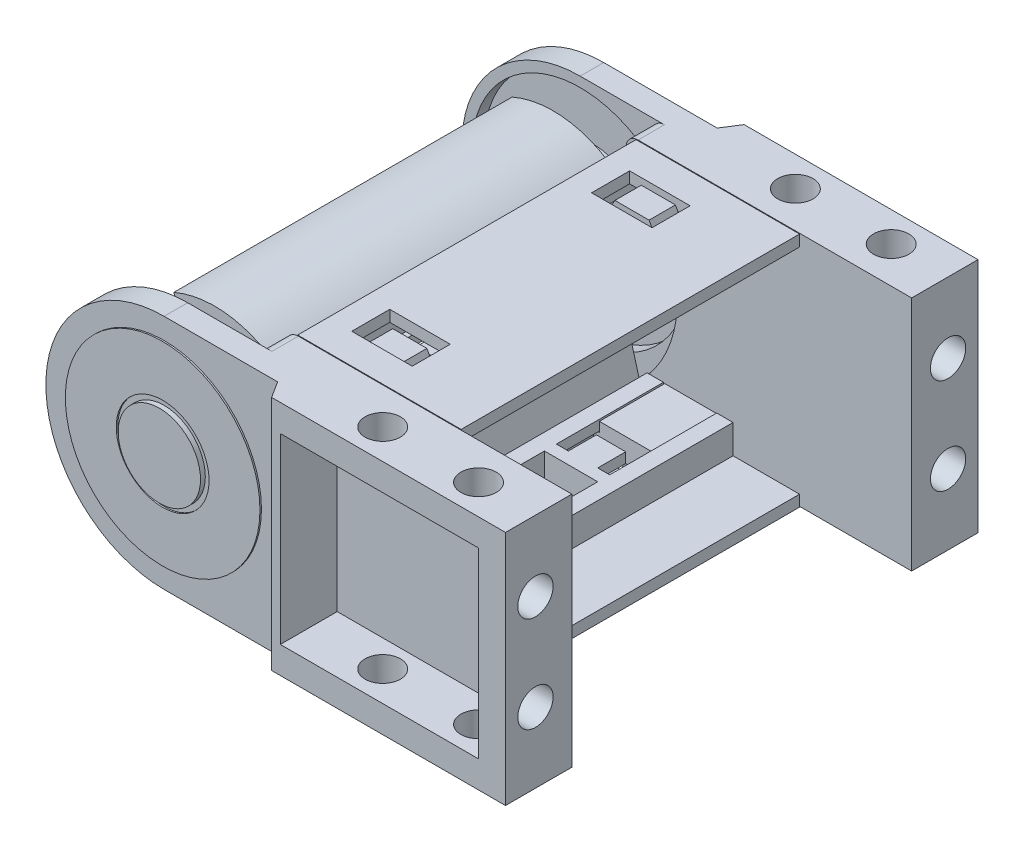
from build123d import *

# Parameters (mm, degrees)
BOSS_EXTRUDE1_START  = 39.45
BOSS_EXTRUDE1_DEPTH  = 11.08
SKETCH2_W            = 33.1
SKETCH2_H            = 30.5
CUT_EXTRUDE1_DEPTH   = 9.5
CUT_EXTRUDE2_DEPTH   = 2.75
CHAMFER1_SIZE2       = 1.75
CHAMFER1_SIZE        = 2.75
SKETCH5_R            = 16.25
SKETCH5_R_2          = 7.75
BOSS_EXTRUDE2_DEPTH  = 0.25
SKETCH5_3_R          = 5.15
CUT_EXTRUDE3_DEPTH   = 64.47845225
SKETCH6_R            = 2.95
CUT_EXTRUDE4_DEPTH   = 82.771724942
CUT_EXTRUDE5_REACH   = 92.921
SKETCH7_R            = 2.95
SKETCH8_R            = 20.65
CUT_EXTRUDE6_DEPTH   = 4.4
CUT_EXTRUDE7_START   = 4.4
SKETCH9_R            = 18.1
CUT_EXTRUDE7_DEPTH   = 6.5
SKETCH10_R           = 7
BOSS_EXTRUDE3_DEPTH  = 3.9
FILLET1_R            = 0.5
CUT_EXTRUDE8_START   = -4.6
SKETCH11_R           = 7
CUT_EXTRUDE8_DEPTH   = 4.6
FILLET2_R            = 2
BOSS_EXTRUDE4_DEPTH  = 10.92
BOSS_EXTRUDE5_START  = -1.1
BOSS_EXTRUDE5_DEPTH  = 4.4
BOSS_EXTRUDE6_DEPTH  = 28.25
SKETCH15_W           = 10.1
SKETCH15_H           = 6.35
CUT_EXTRUDE9_DEPTH   = 5
BOSS_EXTRUDE7_REACH  = 80.754
SKETCH16_W           = 14.35
SKETCH16_H           = 20.75
SKETCH16_W_2         = 8.9
SKETCH16_H_2         = 16.75
SKETCH17_W           = 4.9
SKETCH17_H           = 4.675
BOSS_EXTRUDE8_DEPTH  = 1.7
SKETCH18_R           = 6.875
BOSS_EXTRUDE9_DEPTH  = 0.8
SKETCH19_R           = 5.1
BOSS_EXTRUDE10_DEPTH = 8


with BuildPart() as part:
    # Sketch1 → Boss-Extrude1 (new body)
    with BuildSketch(Plane.XY.offset(BOSS_EXTRUDE1_START)):
        with BuildLine():
            Line((0, 19.75), (59.75, 19.75))
            Line((59.75, 19.75), (59.75, -19.75))
            Line((59.75, -19.75), (0, -19.75))
            ThreePointArc((0, -19.75), (-19.75, 0), (0, 19.75))
        make_face()
    extrude(amount=-BOSS_EXTRUDE1_DEPTH)

    # Sketch2 → Cut-Extrude1 (cut)
    with BuildSketch(Plane.XY.offset(39.45)):
        with Locations((38.7, 0)):
            Rectangle(SKETCH2_W, SKETCH2_H)
    extrude(amount=-CUT_EXTRUDE1_DEPTH, mode=Mode.SUBTRACT)

    # Sketch3 → Cut-Extrude2 (cut)
    with BuildSketch(Plane.XY.offset(39.45)):
        with BuildLine():
            Line((0, -19.75), (18.95, -19.75))
            Line((18.95, -19.75), (18.95, 19.75))
            Line((18.95, 19.75), (0, 19.75))
            ThreePointArc((0, 19.75), (-19.75, 0), (0, -19.75))
        make_face()
    extrude(amount=-CUT_EXTRUDE2_DEPTH, mode=Mode.SUBTRACT)

    # Chamfer1
    chamfer1_edges = [part.edges().sort_by_distance(p)[0] for p in [
        (18.95, 0, 39.45),
    ]]
    chamfer1_side = [part.faces().sort_by_distance(p)[0] for p in [
        (18.95, 0, 39.415),
    ]]
    chamfer(chamfer1_edges, length=CHAMFER1_SIZE - 0.0001, length2=CHAMFER1_SIZE2 - 0.0001, reference=chamfer1_side[0])  # a hair under: the kernel refuses the full size

    # Sketch5 → Boss-Extrude2 (add)
    with BuildSketch(Plane.XY.offset(36.7)):
        Circle(SKETCH5_R)
        Circle(SKETCH5_R_2, mode=Mode.SUBTRACT)
    extrude(amount=BOSS_EXTRUDE2_DEPTH)

    # Sketch5<3> → Cut-Extrude3 (cut, through all)
    with BuildSketch(Plane.XY.offset(36.7)):
        Circle(SKETCH5_3_R)
    extrude(amount=-CUT_EXTRUDE3_DEPTH, mode=Mode.SUBTRACT)

    # Sketch6 → Cut-Extrude4 (cut, through all)
    with BuildSketch(Plane(origin=(0, 19.75, 0), x_dir=(1, 0, 0), z_dir=(0, 1, 0))):
        with Locations(Location((50.25, -34.45, 0), (0, 0, 270))):
            Circle(SKETCH6_R)
        with Locations(Location((34.25, -34.45, 0), (0, 0, 270))):
            Circle(SKETCH6_R)
    extrude(amount=-CUT_EXTRUDE4_DEPTH, mode=Mode.SUBTRACT)

    # Sketch7 → Cut-Extrude5 (cut, up to next)
    with BuildSketch(Plane(origin=(59.75, 0, 0), x_dir=(0, 0, -1), z_dir=(1, 0, 0)), mode=Mode.PRIVATE) as cut_extrude5_sk1:
        with Locations((-34.45, 8)):
            Circle(SKETCH7_R)
    cut_extrude5_tool1 = extrude(cut_extrude5_sk1.sketch, amount=-CUT_EXTRUDE5_REACH, mode=Mode.PRIVATE) & part.part
    # Sketch7 → Cut-Extrude5 (cut, up to next)
    with BuildSketch(Plane(origin=(59.75, 0, 0), x_dir=(0, 0, -1), z_dir=(1, 0, 0)), mode=Mode.PRIVATE) as cut_extrude5_sk2:
        with Locations((-34.45, -8)):
            Circle(SKETCH7_R)
    cut_extrude5_tool2 = extrude(cut_extrude5_sk2.sketch, amount=-CUT_EXTRUDE5_REACH, mode=Mode.PRIVATE) & part.part
    add(cut_extrude5_tool1.solids().sort_by_distance((59.75, 8, 34.45))[0], mode=Mode.SUBTRACT)
    add(cut_extrude5_tool2.solids().sort_by_distance((59.75, -8, 34.45))[0], mode=Mode.SUBTRACT)

    # Sketch8 → Cut-Extrude6 (cut)
    with BuildSketch(Plane(origin=(0, 0, 28.37), x_dir=(-1, 0, 0), z_dir=(0, 0, -1))):
        Circle(SKETCH8_R)
    extrude(amount=-CUT_EXTRUDE6_DEPTH, mode=Mode.SUBTRACT)

    # Sketch9 → Cut-Extrude7 (cut)
    with BuildSketch(Plane(origin=(0, 0, 32.77), x_dir=(-1, 0, 0), z_dir=(0, 0, -1)).offset(CUT_EXTRUDE7_START)):
        Circle(SKETCH9_R)
    extrude(amount=-CUT_EXTRUDE7_DEPTH, mode=Mode.SUBTRACT)

    # Sketch10 → Boss-Extrude3 (add)
    with BuildSketch(Plane(origin=(0, 0, 34.87), x_dir=(-1, 0, 0), z_dir=(0, 0, -1))):
        with BuildLine():
            Line((8.562499635, 2.5), (16.75, 3.2))
            Line((16.75, 3.2), (16.75, -3.2))
            Line((16.75, -3.2), (8.562499635, -2.5))
            ThreePointArc((8.562499635, -2.5), (0, -8.92), (-8.562499635, -2.5))
            Line((-8.562499635, -2.5), (-16.75, -3.2))
            Line((-16.75, -3.2), (-16.75, 3.2))
            Line((-16.75, 3.2), (-8.562499635, 2.5))
            ThreePointArc((-8.562499635, 2.5), (0, 8.92), (8.562499635, 2.5))
        make_face()
        Circle(SKETCH10_R, mode=Mode.SUBTRACT)
        with BuildLine():
            Line((8.872361267, 0.920654955), (15.15, 1.457369083))
            Line((15.15, 1.457369083), (15.15, -1.457369083))
            Line((15.15, -1.457369083), (8.872361267, -0.920654955))
            ThreePointArc((8.872361267, -0.920654955), (8.92, 0), (8.872361267, 0.920654955))
        make_face(mode=Mode.SUBTRACT)
        with BuildLine():
            Line((-8.872361267, 0.920654955), (-15.15, 1.457369083))
            Line((-15.15, 1.457369083), (-15.15, -1.457369083))
            Line((-15.15, -1.457369083), (-8.872361267, -0.920654955))
            ThreePointArc((-8.872361267, -0.920654955), (-8.92, 0), (-8.872361267, 0.920654955))
        make_face(mode=Mode.SUBTRACT)
    extrude(amount=BOSS_EXTRUDE3_DEPTH)

    # Fillet1
    fillet1_edges = [part.edges().sort_by_distance(p)[0] for p in [
        (16.75, 3.2, 32.92),
        (16.75, -3.2, 32.92),
        (-16.75, -3.2, 32.92),
        (-16.75, 3.2, 32.92),
    ]]
    fillet(fillet1_edges, radius=FILLET1_R)

    # Sketch11 → Cut-Extrude8 (cut)
    with BuildSketch(Plane(origin=(0, 0, 30.97), x_dir=(-1, 0, 0), z_dir=(0, 0, -1)).offset(CUT_EXTRUDE8_START)):
        Circle(SKETCH11_R)
    extrude(amount=CUT_EXTRUDE8_DEPTH, mode=Mode.SUBTRACT)

    # Fillet2
    fillet2_edges = [part.edges().sort_by_distance(p)[0] for p in [
        (6.029925373, 19.75, 30.57),
        (6.029925373, -19.75, 30.57),
    ]]
    fillet(fillet2_edges, radius=FILLET2_R)

    # Sketch12 → Boss-Extrude4 (add)
    with BuildSketch(Plane(origin=(0, 0, 28.37), x_dir=(-1, 0, 0), z_dir=(0, 0, -1))):
        Polygon((-27.425, 17.15), (-18.325, 17.15), (-17.5, 15.65), (-17.5, 14.85), (-18.525, 14.85), (-18.525, 13.25), (-27.225, 13.25), (-27.225, 14.85), (-28.25, 14.85), (-28.25, 15.65), align=None)
        Polygon((-17.5, -15.65), (-17.5, -14.85), (-18.525, -14.85), (-18.525, -13.25), (-27.225, -13.25), (-27.225, -14.85), (-28.25, -14.85), (-28.25, -15.65), (-27.425, -17.15), (-18.325, -17.15), align=None)
    extrude(amount=BOSS_EXTRUDE4_DEPTH)

    # Sketch13 → Boss-Extrude5 (add)
    with BuildSketch(Plane(origin=(0, 0, 17.45), x_dir=(-1, 0, 0), z_dir=(0, 0, -1)).offset(BOSS_EXTRUDE5_START)):
        Polygon((-26.7, 17.15), (-25.725, 18.9), (-20.025, 18.9), (-19.05, 17.15), align=None)
        Polygon((-20.025, -18.9), (-19.05, -17.15), (-26.7, -17.15), (-25.725, -18.9), align=None)
    extrude(amount=-BOSS_EXTRUDE5_DEPTH)


with BuildPart() as body_2:
    # Sketch14 → Boss-Extrude6 (new, symmetric)
    with BuildSketch(Plane.XY):
        with BuildLine():
            Line((41.15, 19.75), (13.85, 19.75))
            Line((13.85, 19.75), (11.787175234, 12.25))
            ThreePointArc((11.787175234, 12.25), (2.971704939, 16.738248706), (-6.85, 15.558839931))
            Line((-6.85, 15.558839931), (-6.092470588, 13.83821528))
            ThreePointArc((-6.092470588, 13.83821528), (4.294757816, 14.497222331), (12.646917657, 8.286728775))
            Line((12.646917657, 8.286728775), (15.28273222, 17.87))
            Line((15.28273222, 17.87), (15.7, 17.87))
            Line((15.7, 17.87), (15.7, 13.05))
            Line((15.7, 13.05), (18.425, 13.05))
            Line((18.425, 13.05), (18.425, 14.75))
            Line((18.425, 14.75), (17.4, 14.75))
            Line((17.4, 14.75), (17.4, 17.87))
            Line((17.4, 17.87), (28.35, 17.87))
            Line((28.35, 17.87), (28.35, 14.75))
            Line((28.35, 14.75), (27.325, 14.75))
            Line((27.325, 14.75), (27.325, 13.05))
            Line((27.325, 13.05), (30.05, 13.05))
            Line((30.05, 13.05), (30.05, 17.87))
            Line((30.05, 17.87), (41.15, 17.87))
            Line((41.15, 17.87), (41.15, 19.75))
        make_face()
    extrude(amount=BOSS_EXTRUDE6_DEPTH, both=True)

    # Sketch15 → Cut-Extrude9 (cut)
    with BuildSketch(Plane(origin=(0, 19.75, 0), x_dir=(1, 0, 0), z_dir=(0, 1, 0))):
        with Locations((22.875, -20.025)):
            Rectangle(SKETCH15_W, SKETCH15_H)
        with Locations((22.875, 20.025)):
            Rectangle(SKETCH15_W, SKETCH15_H)
    extrude(amount=-CUT_EXTRUDE9_DEPTH, mode=Mode.SUBTRACT)

    # Boss-Extrude7: up to this face of the body (flat: up to its plane)
    boss_extrude7_end = Plane(body_2.part.faces().sort_by_distance((35.6, 17.87, 0))[0])
    # Sketch16 → Boss-Extrude7 (add, up to the picked face)
    with BuildSketch(Plane.XZ.offset(-13.05), mode=Mode.PRIVATE) as boss_extrude7_sk1:
        with Locations((22.875, 0)):
            Rectangle(SKETCH16_W, SKETCH16_H)
        with Locations((22.875, 0)):
            Rectangle(SKETCH16_W_2, SKETCH16_H_2, mode=Mode.SUBTRACT)
    boss_extrude7_tool1 = split(extrude(boss_extrude7_sk1.sketch, amount=-BOSS_EXTRUDE7_REACH, mode=Mode.PRIVATE), bisect_by=boss_extrude7_end, keep=Keep.BOTH, mode=Mode.PRIVATE)
    add(boss_extrude7_tool1.solids().sort_by(Axis((22.875, 13.05, 10.122713), (0, 1, 0)))[0])

    # Sketch17 → Boss-Extrude8 (add)
    with BuildSketch(Plane.XZ.offset(-13.05)):
        with Locations((22.875, 12.7125)):
            Rectangle(SKETCH17_W, SKETCH17_H)
        with Locations((22.875, -12.7125)):
            Rectangle(SKETCH17_W, SKETCH17_H)
    extrude(amount=-BOSS_EXTRUDE8_DEPTH)


with BuildPart() as body_3:
    # Sketch18 → Boss-Extrude9 (new body)
    with BuildSketch(Plane.XY.offset(36.7)):
        Circle(SKETCH18_R)
    extrude(amount=BOSS_EXTRUDE9_DEPTH)

    # Sketch19 → Boss-Extrude10 (add)
    with BuildSketch(Plane(origin=(0, 0, 36.7), x_dir=(-1, 0, 0), z_dir=(0, 0, -1))):
        Circle(SKETCH19_R)
    extrude(amount=BOSS_EXTRUDE10_DEPTH)


with BuildPart() as body_4:
    # Mirror1: mirrored copy
    add(part.part.mirror(Plane.XY))


with BuildPart() as body_5:
    # Mirror1 2: mirrored copy
    add(body_3.part.mirror(Plane.XY))


with BuildPart() as body_6:
    # Mirror2: mirrored copy
    add(body_2.part.mirror(Plane.ZX))


solid = Compound([part.part, body_2.part, body_3.part, body_4.part, body_5.part, body_6.part])
